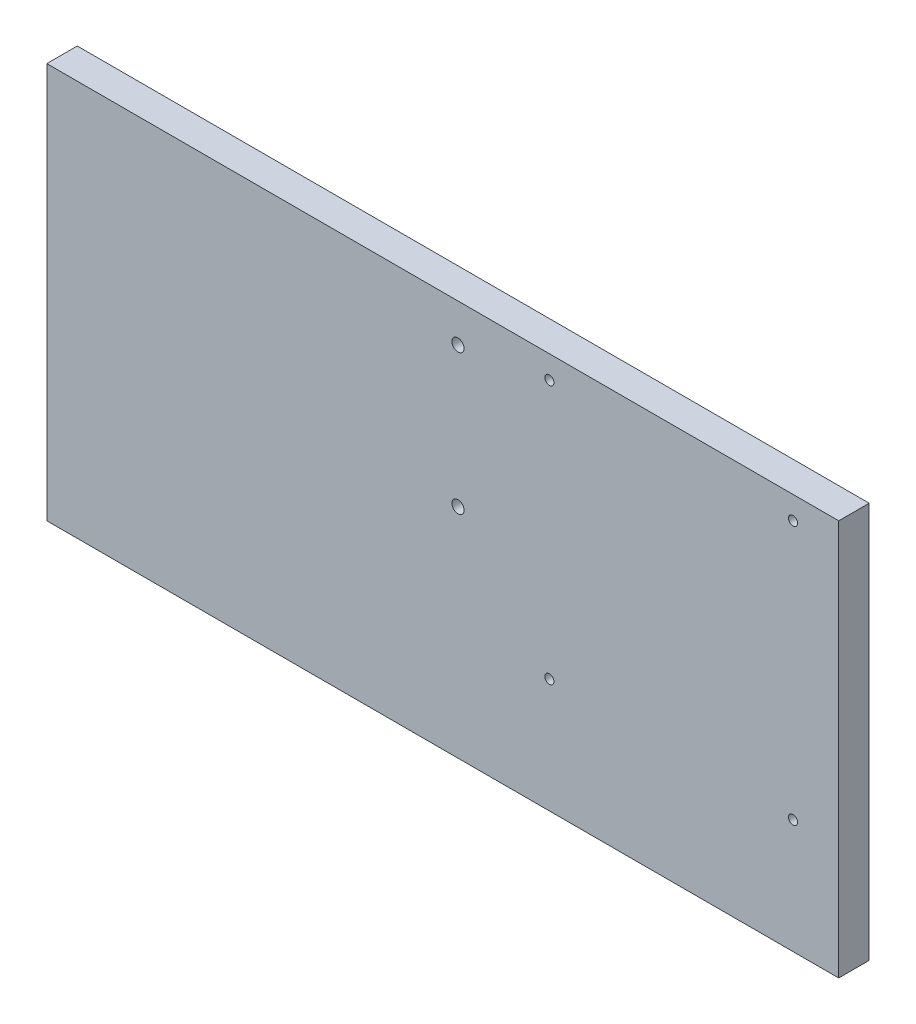
from build123d import *

# Parameters (mm, degrees)
ESBO_O1_W                = 260
ESBO_O1_H                = 130
ESBO_O1_R                = 1.5
ESBO_O1_R_2              = 2
RESSALTO_EXTRUS_O1_DEPTH = 10


with BuildPart() as part:
    # Esboço1 → Ressalto-extrusão1 (new body)
    with BuildSketch(Plane.XY):
        Rectangle(ESBO_O1_W, ESBO_O1_H)
        with Locations((35, -27.5)):
            Circle(ESBO_O1_R, mode=Mode.SUBTRACT)
        with Locations((115, -27.5)):
            Circle(ESBO_O1_R, mode=Mode.SUBTRACT)
        with Locations((5, 6.5)):
            Circle(ESBO_O1_R_2, mode=Mode.SUBTRACT)
        with Locations((5, 52.5)):
            Circle(ESBO_O1_R_2, mode=Mode.SUBTRACT)
        with Locations((35, 57.5)):
            Circle(ESBO_O1_R, mode=Mode.SUBTRACT)
        with Locations((115, 57.5)):
            Circle(ESBO_O1_R, mode=Mode.SUBTRACT)
    extrude(amount=RESSALTO_EXTRUS_O1_DEPTH)


solid = part.part
